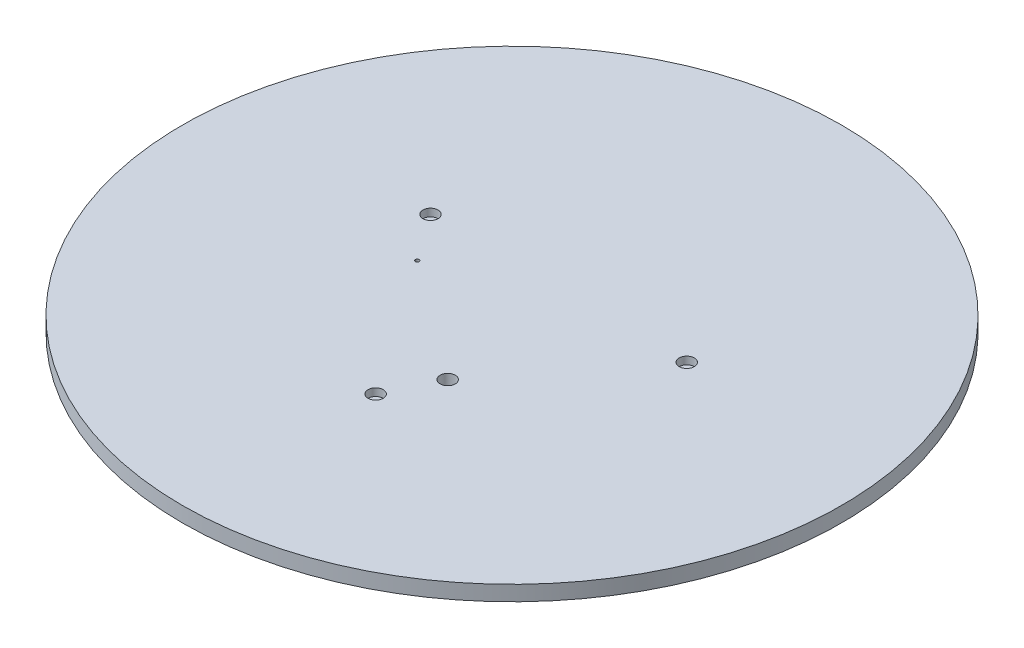
from build123d import *

# Parameters (mm, degrees)
SKETCH1_R               = 43.5
BOSS_EXTRUDE1_DEPTH     = 2
CUT_EXTRUDE1_DEPTH      = 62.550792034
CUT_EXTRUDE1_DEPTH_BACK = 62.550792034
SKETCH2_R               = 0.25
CUT_EXTRUDE2_DEPTH      = 62.550792034
CUT_EXTRUDE2_DEPTH_BACK = 62.550792034
SKETCH3_R               = 1
SKETCH4_R               = 1
CUT_EXTRUDE3_DEPTH      = 1


with BuildPart() as part:
    # Sketch1 → Boss-Extrude1 (new body)
    with BuildSketch(Plane(origin=(0, 0, 0), x_dir=(1, 0, 0), z_dir=(0, 1, 0))):
        Circle(SKETCH1_R)
    extrude(amount=BOSS_EXTRUDE1_DEPTH)

    # Sketch2 → Cut-Extrude1 (cut, two sides: drawn at the far end of the back side and taken through both)
    with BuildSketch(Plane(origin=(0, 2, 0), x_dir=(1, 0, 0), z_dir=(0, 1, 0)).offset(-CUT_EXTRUDE1_DEPTH_BACK)):
        with Locations((-12.5, 0)):
            Circle(SKETCH2_R)
    extrude(amount=CUT_EXTRUDE1_DEPTH + CUT_EXTRUDE1_DEPTH_BACK, mode=Mode.SUBTRACT)

    # Sketch3 → Cut-Extrude2 (cut, two sides: drawn at the far end of the back side and taken through both)
    with BuildSketch(Plane(origin=(0, 2, 0), x_dir=(1, 0, 0), z_dir=(0, 1, 0)).offset(-CUT_EXTRUDE2_DEPTH_BACK)):
        with Locations((3.105828541, -11.591109915)):
            Circle(SKETCH3_R)
    extrude(amount=CUT_EXTRUDE2_DEPTH + CUT_EXTRUDE2_DEPTH_BACK, mode=Mode.SUBTRACT)

    # Sketch4 → Cut-Extrude3 (cut)
    with BuildSketch(Plane(origin=(0, 2, 0), x_dir=(1, 0, 0), z_dir=(0, 1, 0))):
        with Locations((0, -18)):
            Circle(SKETCH4_R)
        with Locations((-16.914467174, 6.15636258)):
            Circle(SKETCH4_R)
        with Locations((16.914467174, 6.15636258)):
            Circle(SKETCH4_R)
    extrude(amount=-CUT_EXTRUDE3_DEPTH, mode=Mode.SUBTRACT)


solid = part.part
